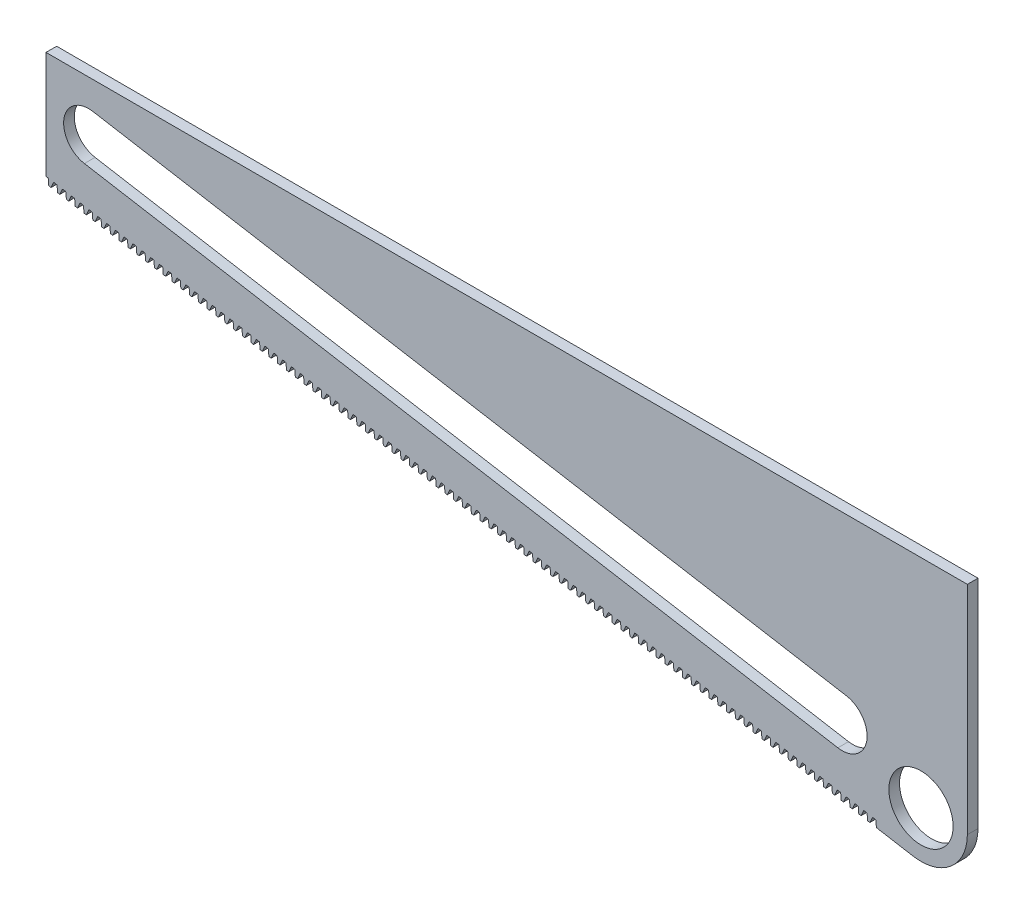
from build123d import *

# Parameters (mm, degrees)
SKETCH1_R           = 14.351
BOSS_EXTRUDE1_DEPTH = 4.7625
CUT_EXTRUDE2_DEPTH  = 246.114977248
LPATTERN2_COUNT     = 95
LPATTERN2_PITCH     = 3.99034


with BuildPart() as part:
    # Sketch1 → Boss-Extrude1 (new body)
    with BuildSketch(Plane.XY):
        with BuildLine():
            Line((165.488658827, -13.163856035), (-221.861341173, 53.297146733))
            Line((-221.861341173, 53.297146733), (-221.861341173, 104.097146733))
            Line((-221.861341173, 104.097146733), (189.69035399, 104.097146733))
            Line((189.69035399, 104.097146733), (189.69035399, 7.239))
            ThreePointArc((189.69035399, 7.239), (182.332208078, -8.588180601), (165.488658827, -13.163856035))
        make_face()
        with Locations((168.98935399, 7.239)):
            Circle(SKETCH1_R, mode=Mode.SUBTRACT)
        with BuildLine():
            Line((131.848712972, 11.93641644), (-204.701287028, 69.681222123))
            ThreePointArc((-204.701287028, 69.681222123), (-213.826380014, 82.586206819), (-200.921395318, 91.711299805))
            Line((-200.921395318, 91.711299805), (135.628604682, 33.966494122))
            ThreePointArc((135.628604682, 33.966494122), (144.753697668, 21.061509426), (131.848712972, 11.93641644))
        make_face(mode=Mode.SUBTRACT)
    extrude(amount=BOSS_EXTRUDE1_DEPTH)

    # Sketch2 → Cut-Extrude2 (cut, through all)
    with BuildSketch(Plane.XY.offset(4.7625)):
        with BuildLine():
            Line((-220.622365573, 53.148973261), (-220.839182438, 55.750542585))
            ThreePointArc((-220.839182438, 55.750542585), (-220.918257826, 55.93120313), (-221.091385419, 56.025638221))
            Line((-221.091385419, 56.025638221), (-222.115857148, 56.20141573))
            ThreePointArc((-222.115857148, 56.20141573), (-222.310562125, 56.170092868), (-222.445336922, 56.026124455))
            Line((-222.445336922, 56.026124455), (-223.516970456, 53.645625754))
            ThreePointArc((-223.516970456, 53.645625754), (-223.539432922, 53.621631019), (-223.571883751, 53.616410542))
            Line((-223.571883751, 53.616410542), (-224.042542467, 53.697165544))
            Line((-224.042542467, 53.697165544), (-224.046837798, 53.672131365))
            Line((-224.046837798, 53.672131365), (-223.576179083, 53.591376363))
            Line((-223.576179083, 53.591376363), (-220.584627075, 53.07808981))
            Line((-220.584627075, 53.07808981), (-220.113968359, 52.997334807))
            Line((-220.113968359, 52.997334807), (-220.109673027, 53.022368986))
            Line((-220.109673027, 53.022368986), (-220.580331743, 53.103123989))
            ThreePointArc((-220.580331743, 53.103123989), (-220.609186342, 53.118863171), (-220.622365573, 53.148973261))
        make_face()
    cut_extrude2 = extrude(amount=-CUT_EXTRUDE2_DEPTH, mode=Mode.SUBTRACT)

    # LPattern2: Cut-Extrude2 ×95
    with Locations(*[Vector(0.9855976056602136, -0.16910753891194252, 0) * (i * LPATTERN2_PITCH) for i in range(1, LPATTERN2_COUNT)]):
        add(cut_extrude2, mode=Mode.SUBTRACT)


solid = part.part
